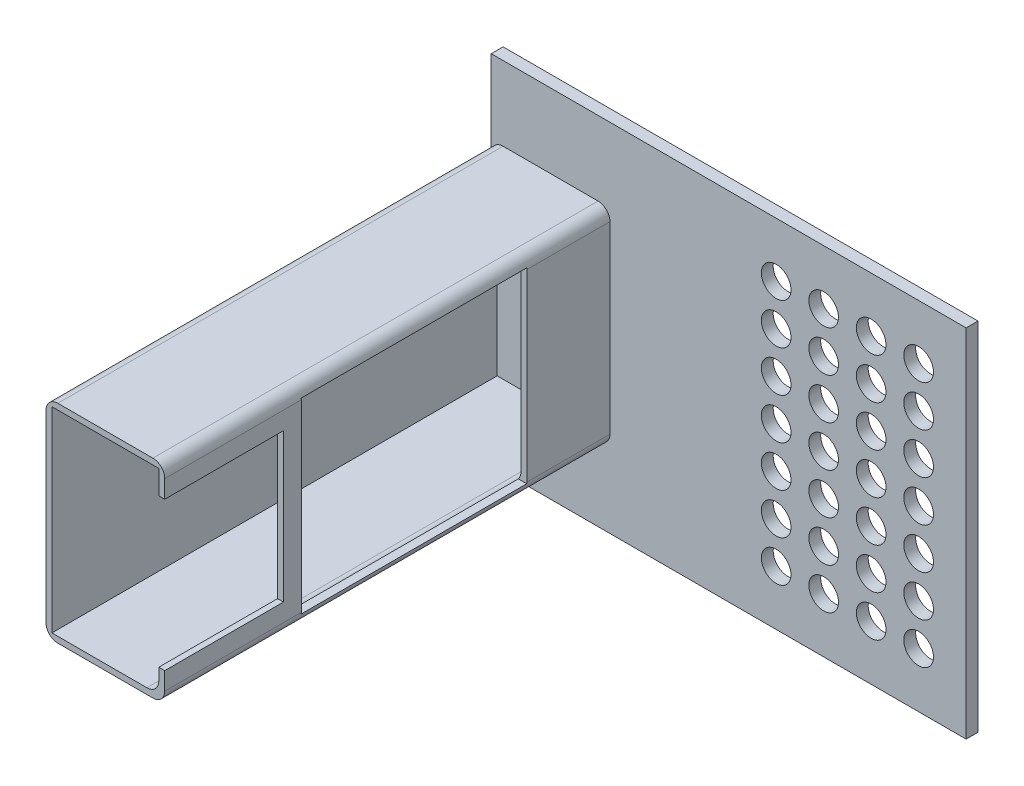
from build123d import *

# Parameters (mm, degrees)
SKETCH_1_W             = 80
SKETCH_1_H             = 60
EXTRUDE_1_DEPTH        = 2
SKETCH_3_R             = 2.5
HONEYCOMBCOOLING_DEPTH = 101.019998
SKETCH_4_W             = 20
SKETCH_4_H             = 35
EXTRUDE_2_DEPTH        = 75
SKETCH_5_W             = 18
SKETCH_5_H             = 33
CUT_EXTRUDE_3_DEPTH    = 75
SKETCH_6_W             = 38
SKETCH_6_H             = 31.5
CUT_EXTRUDE_4_DEPTH    = 8
SKETCH_9_W             = 20
SKETCH_9_H             = 25
CUT_EXTRUDE_5_DEPTH    = 10
FILLET_1_R             = 2
FILLET_2_R             = 2


with BuildPart() as part:
    # 草图1 → 凸台-拉伸1 (new body)
    with BuildSketch(Plane.XY):
        with Locations((40, -30)):
            Rectangle(SKETCH_1_W, SKETCH_1_H)
    extrude(amount=EXTRUDE_1_DEPTH)

    # 草图3 → HoneycombCooling (cut, through all)
    with BuildSketch(Plane.XY.offset(2)):
        with Locations((48, -50.784609691)):
            Circle(SKETCH_3_R)
        with Locations((56, -50.784609691)):
            Circle(SKETCH_3_R)
        with Locations((64, -50.784609691)):
            Circle(SKETCH_3_R)
        with Locations((72, -50.784609691)):
            Circle(SKETCH_3_R)
        with Locations((48, -43.856406461)):
            Circle(SKETCH_3_R)
        with Locations((56, -43.856406461)):
            Circle(SKETCH_3_R)
        with Locations((64, -43.856406461)):
            Circle(SKETCH_3_R)
        with Locations((72, -43.856406461)):
            Circle(SKETCH_3_R)
        with Locations((48, -36.92820323)):
            Circle(SKETCH_3_R)
        with Locations((56, -36.92820323)):
            Circle(SKETCH_3_R)
        with Locations((64, -36.92820323)):
            Circle(SKETCH_3_R)
        with Locations((72, -36.92820323)):
            Circle(SKETCH_3_R)
        with Locations((48, -30)):
            Circle(SKETCH_3_R)
        with Locations((56, -30)):
            Circle(SKETCH_3_R)
        with Locations((64, -30)):
            Circle(SKETCH_3_R)
        with Locations((72, -30)):
            Circle(SKETCH_3_R)
        with Locations((48, -23.07179677)):
            Circle(SKETCH_3_R)
        with Locations((56, -23.07179677)):
            Circle(SKETCH_3_R)
        with Locations((64, -23.07179677)):
            Circle(SKETCH_3_R)
        with Locations((72, -23.07179677)):
            Circle(SKETCH_3_R)
        with Locations((48, -16.143593539)):
            Circle(SKETCH_3_R)
        with Locations((56, -16.143593539)):
            Circle(SKETCH_3_R)
        with Locations((64, -16.143593539)):
            Circle(SKETCH_3_R)
        with Locations((72, -16.143593539)):
            Circle(SKETCH_3_R)
        with Locations((48, -9.215390309)):
            Circle(SKETCH_3_R)
        with Locations((56, -9.215390309)):
            Circle(SKETCH_3_R)
        with Locations((64, -9.215390309)):
            Circle(SKETCH_3_R)
        with Locations((72, -9.215390309)):
            Circle(SKETCH_3_R)
    extrude(amount=-HONEYCOMBCOOLING_DEPTH, mode=Mode.SUBTRACT)

    # 草图4 → 凸台-拉伸2 (add)
    with BuildSketch(Plane.XY.offset(2)):
        with Locations((10, -30)):
            Rectangle(SKETCH_4_W, SKETCH_4_H)
    extrude(amount=EXTRUDE_2_DEPTH)

    # 草图5 → 切除-拉伸3 (cut)
    with BuildSketch(Plane.XY.offset(77)):
        with Locations((10, -30)):
            Rectangle(SKETCH_5_W, SKETCH_5_H)
    extrude(amount=-CUT_EXTRUDE_3_DEPTH, mode=Mode.SUBTRACT)

    # 草图6 → 切除-拉伸4 (cut)
    with BuildSketch(Plane(origin=(20, 0, 0), x_dir=(0, 0, -1), z_dir=(1, 0, 0))):
        with Locations((-35, -30)):
            Rectangle(SKETCH_6_W, SKETCH_6_H)
    extrude(amount=-CUT_EXTRUDE_4_DEPTH, mode=Mode.SUBTRACT)

    # 草图9 → 切除-拉伸5 (cut)
    with BuildSketch(Plane(origin=(20, 0, 0), x_dir=(0, 0, -1), z_dir=(1, 0, 0))):
        with Locations((-67, -30)):
            Rectangle(SKETCH_9_W, SKETCH_9_H)
    extrude(amount=-CUT_EXTRUDE_5_DEPTH, mode=Mode.SUBTRACT)

    # 圆角1
    # the kernel refuses this fillet: 2 mm, written as the material it adds along each edge
    with BuildSketch(Plane(origin=(19, -46.5, 77), x_dir=(0, 1, 0), z_dir=(0, 0, -1))) as fillet_1_piece_1_section:
        with BuildLine():
            CenterArc((FILLET_1_R, -FILLET_1_R), FILLET_1_R, 90, 90)
            Line((0, -FILLET_1_R), (0, 0))
            Line((0, 0), (FILLET_1_R, 0))
        make_face()
    fillet_1_piece_1 = extrude(amount=80, mode=Mode.PRIVATE)
    fillet_1_piece_1 = split(fillet_1_piece_1, bisect_by=Plane(origin=(18.871282618, -45.444770831, 54), z_dir=(0, 0, 1)), keep=Keep.TOP, mode=Mode.PRIVATE)
    add(fillet_1_piece_1)
    with BuildSketch(Plane(origin=(19, -46.5, 82), x_dir=(0, 1, 0), z_dir=(0, 0, -1))) as fillet_1_piece_2_section:
        with BuildLine():
            CenterArc((FILLET_1_R, -FILLET_1_R), FILLET_1_R, 90, 90)
            Line((0, -FILLET_1_R), (0, 0))
            Line((0, 0), (FILLET_1_R, 0))
        make_face()
    fillet_1_piece_2 = extrude(amount=80, mode=Mode.PRIVATE)
    fillet_1_piece_2 = split(fillet_1_piece_2, bisect_by=Plane(origin=(18.472438473, -46.20791508, 54), z_dir=(0, 0, -1)), keep=Keep.TOP, mode=Mode.PRIVATE)
    fillet_1_piece_2 = split(fillet_1_piece_2, bisect_by=Plane(origin=(18.472438473, -45.75, 35), z_dir=(0, -1, 0)), keep=Keep.TOP, mode=Mode.PRIVATE)
    add(fillet_1_piece_2)
    with BuildSketch(Plane(origin=(19, -46.5, 82), x_dir=(0, 1, 0), z_dir=(0, 0, -1))) as fillet_1_piece_3_section:
        with BuildLine():
            CenterArc((FILLET_1_R, -FILLET_1_R), FILLET_1_R, 90, 90)
            Line((0, -FILLET_1_R), (0, 0))
            Line((0, 0), (FILLET_1_R, 0))
        make_face()
    fillet_1_piece_3 = extrude(amount=80, mode=Mode.PRIVATE)
    fillet_1_piece_3 = split(fillet_1_piece_3, bisect_by=Plane(origin=(18.871282618, -45.444770831, 16), z_dir=(0, 0, -1)), keep=Keep.TOP, mode=Mode.PRIVATE)
    add(fillet_1_piece_3)
    # the kernel refuses this fillet: 2 mm, written as the material it takes off along each edge
    with BuildSketch(Plane(origin=(0, -47.5, 2), x_dir=(1, 0, 0), z_dir=(0, 0, 1))) as fillet_1_2_piece_1:
        with BuildLine():
            CenterArc((FILLET_1_R, FILLET_1_R), FILLET_1_R, 180, 90)
            Line((0, FILLET_1_R), (0, 0))
            Line((0, 0), (FILLET_1_R, 0))
        make_face()
    extrude(amount=80, mode=Mode.SUBTRACT)
    with BuildSketch(Plane(origin=(0, -12.5, 2), x_dir=(1, 0, 0), z_dir=(0, 0, 1)), Plane(origin=(20, -12.5, 2), x_dir=(0, -1, 0), z_dir=(0, 0, 1))) as fillet_1_2_piece_2:
        with BuildLine():
            CenterArc((FILLET_1_R, -FILLET_1_R), FILLET_1_R, 90, 90)
            Line((0, -FILLET_1_R), (0, 0))
            Line((0, 0), (FILLET_1_R, 0))
        make_face()
    extrude(amount=80, mode=Mode.SUBTRACT)

    # 圆角2
    # the kernel refuses this fillet: 2 mm, written as the material it takes off along each edge
    with BuildSketch(Plane(origin=(20, -47.5, 2), x_dir=(-1, 0, 0), z_dir=(0, 0, 1))) as fillet_2_piece_1:
        with BuildLine():
            CenterArc((FILLET_2_R, -FILLET_2_R), FILLET_2_R, 90, 90)
            Line((0, -FILLET_2_R), (0, 0))
            Line((0, 0), (FILLET_2_R, 0))
        make_face()
    extrude(amount=80, mode=Mode.SUBTRACT)


solid = part.part
